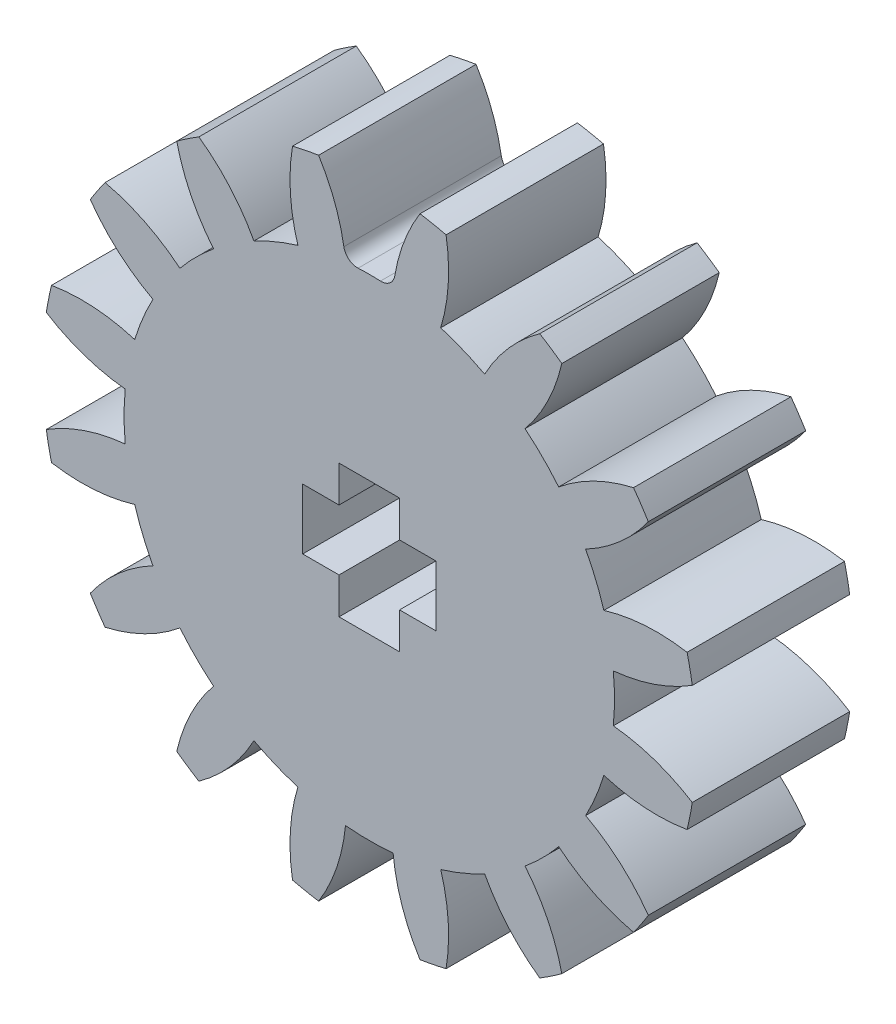
from build123d import *

# Parameters (mm, degrees)
SKETCH1_R           = 13.5
BOSS_EXTRUDE1_DEPTH = 3.25
CUT_EXTRUDE1_DEPTH  = 20.366530407
FILLET1_R           = 0.57
CIRPATTERN3_COUNT   = 16


with BuildPart() as part:
    # Sketch1 → Boss-Extrude1 (new, symmetric)
    with BuildSketch(Plane.XY):
        Circle(SKETCH1_R)
        Polygon((1.25, 2.75), (1.25, 1.25), (2.75, 1.25), (2.75, -1.25), (1.25, -1.25), (1.25, -2.75), (-1.25, -2.75), (-1.25, -1.25), (-2.75, -1.25), (-2.75, 1.25), (-1.25, 1.25), (-1.25, 2.75), align=None, mode=Mode.SUBTRACT)
    extrude(amount=BOSS_EXTRUDE1_DEPTH, both=True)

    # Sketch2 → Cut-Extrude1 (cut, symmetric)
    with BuildSketch(Plane.XY):
        with BuildLine():
            ThreePointArc((0.982234387, 10.077243701), (0, 10.125), (-0.982234387, 10.077243701))
            ThreePointArc((-0.982234387, 10.077243701), (-1.348268622, 11.771504161), (-2.092826994, 13.336794037))
            ThreePointArc((-2.092826994, 13.336794037), (0, 13.5), (2.092826994, 13.336794037))
            ThreePointArc((2.092826994, 13.336794037), (1.348268622, 11.771504161), (0.982234387, 10.077243701))
        make_face()
    cut_extrude1 = extrude(amount=CUT_EXTRUDE1_DEPTH, both=True, mode=Mode.SUBTRACT)

    # Fillet1
    fillet1_edges = [part.edges().sort_by_distance(p)[0] for p in [
        (0.982234387, 10.077243701, 0),
        (-0.982234387, 10.077243701, 0),
    ]]
    fillet(fillet1_edges, radius=FILLET1_R)

    # CirPattern3: Cut-Extrude1 ×16 about axis
    cirpattern3_axis = Axis((0, 0, 3.25), (0, 0, -1))
    for i in range(1, CIRPATTERN3_COUNT):
        add(cut_extrude1.rotate(cirpattern3_axis, i * 360 / CIRPATTERN3_COUNT), mode=Mode.SUBTRACT)


solid = part.part
